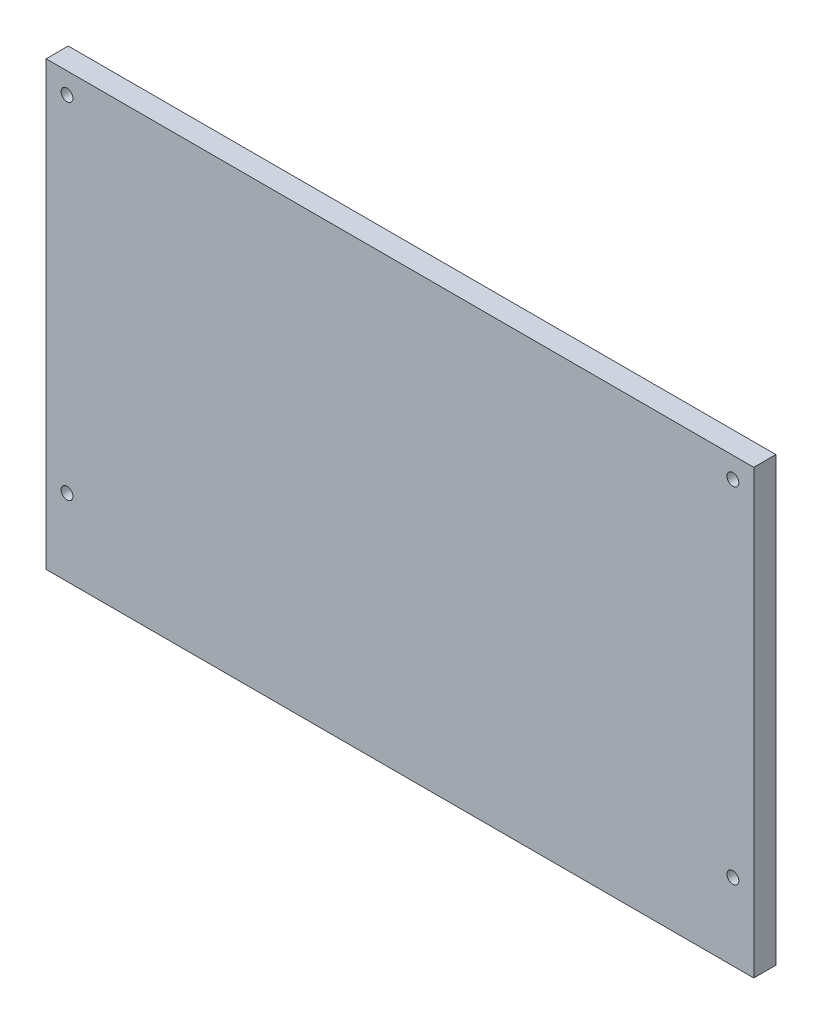
from build123d import *

# Parameters (mm, degrees)
SKETCH1_W            = 203.2
SKETCH1_H            = 127
BOSS_EXTRUDE1_DEPTH  = 6.35
M3_CLEARANCE_HOLE1_D = 3.4


with BuildPart() as part:
    # Sketch1 → Boss-Extrude1 (new body)
    with BuildSketch(Plane.XY):
        with Locations((101.6, 63.5)):
            Rectangle(SKETCH1_W, SKETCH1_H)
    extrude(amount=BOSS_EXTRUDE1_DEPTH)

    # M3 Clearance Hole1 (through all)
    with Locations(Plane.XY.offset(6.35)):
        with Locations((5.9944, 121.0056), (5.9944, 21.9964), (197.2056, 21.9964), (197.2056, 121.0056)):
            Hole(M3_CLEARANCE_HOLE1_D / 2)


solid = part.part
